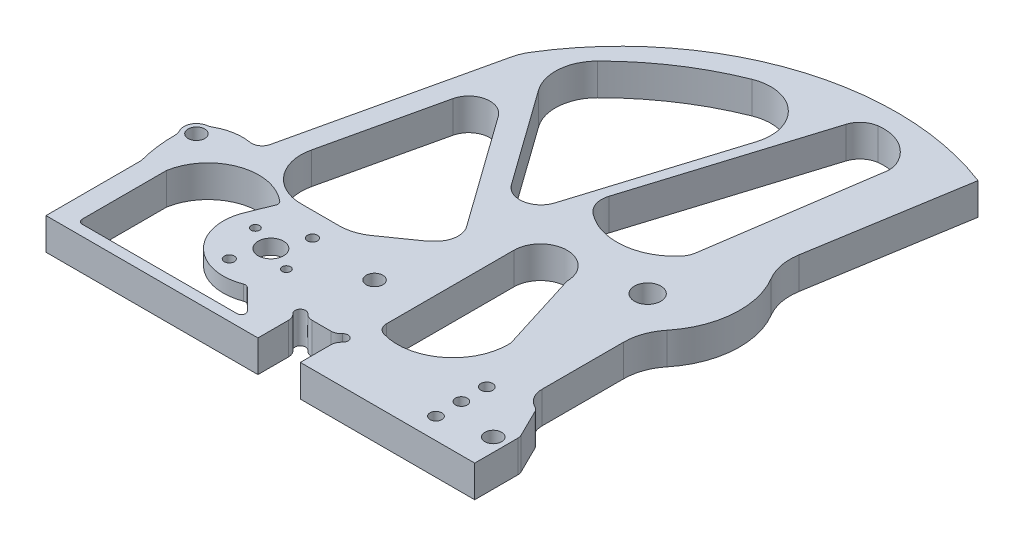
from build123d import *

# Parameters (mm, degrees)
SKETCH1_R                = 4.7625
SKETCH1_W                = 139.7
SKETCH1_H                = 38.1
BOSS_EXTRUDE1_DEPTH      = 9.525
CUT_EXTRUDE4_DEPTH       = 106.62050594
CUT_EXTRUDE4_DEPTH_BACK  = 106.62050594
SKETCH5_W                = 20.32
SKETCH5_H                = 77.381530754
FILLET9_R                = 12.7
BOSS_EXTRUDE4_DEPTH      = 9.525
FILLET13_R               = 12.7
FILLET14_R               = 6.35
CUT_EXTRUDE5_DEPTH       = 150.690104128
CUT_EXTRUDE5_DEPTH_BACK  = 150.690104128
SKETCH7_W                = 12.7
SKETCH7_H                = 6.35
FILLET15_R               = 1.27
SKETCH8_W                = 59.69
SKETCH8_H                = 3.175
SKETCH8_W_2              = 12.7
BOSS_EXTRUDE5_DEPTH      = 9.525
SKETCH9_R                = 14.2875
CUT_EXTRUDE6_DEPTH       = 5.08
CUT_EXTRUDE7_DEPTH       = 150.473101419
CUT_EXTRUDE7_DEPTH_BACK  = 150.473101419
SKETCH10_R               = 1.651
BOSS_EXTRUDE6_START      = -9.525
BOSS_EXTRUDE6_DEPTH      = 9.525
FILLET16_R               = 15.24
SKETCH12_R               = 1.25
SKETCH12_R_2             = 1.5
CUT_EXTRUDE8_DEPTH       = 4.445
CUT_EXTRUDE10_DEPTH      = 150.690104128
CUT_EXTRUDE10_DEPTH_BACK = 150.690104128
SKETCH13_R               = 2.4892
CUT_EXTRUDE11_DEPTH      = 150.690104128
CUT_EXTRUDE11_DEPTH_BACK = 150.690104128
SKETCH15_R               = 2.5
BOSS_EXTRUDE7_DEPTH      = 9.525
CUT_EXTRUDE12_DEPTH      = 150.690104128
CUT_EXTRUDE12_DEPTH_BACK = 150.690104128
SKETCH19_R               = 2.4892
BOSS_EXTRUDE8_DEPTH      = 9.525
SKETCH22_R               = 2.4892
BOSS_EXTRUDE9_DEPTH      = 9.525
CUT_EXTRUDE13_DEPTH      = 150.690104128
CUT_EXTRUDE13_DEPTH_BACK = 150.690104128
SKETCH23_R               = 2.4892
BOSS_EXTRUDE10_DEPTH     = 9.525
BOSS_EXTRUDE11_START     = -9.525
SKETCH26_R               = 2.4892
BOSS_EXTRUDE11_DEPTH     = 9.525
CUT_EXTRUDE14_DEPTH      = 150.690104128
CUT_EXTRUDE14_DEPTH_BACK = 150.690104128
SKETCH25_R               = 2.4892
SKETCH27_W               = 46.99
SKETCH27_H               = 3.175
BOSS_EXTRUDE12_DEPTH     = 9.525
CUT_EXTRUDE15_DEPTH      = 150.690104128
CUT_EXTRUDE15_DEPTH_BACK = 150.690104128
SKETCH28_R               = 1.778
CUT_EXTRUDE16_DEPTH      = 150.690104128
CUT_EXTRUDE16_DEPTH_BACK = 150.690104128
SKETCH29_W               = 12.7
SKETCH29_H               = 12.7
SKETCH31_R               = 2.4892
BOSS_EXTRUDE13_DEPTH     = 9.525
CUT_EXTRUDE18_DEPTH      = 150.690104128
CUT_EXTRUDE18_DEPTH_BACK = 150.690104128
FILLET17_R               = 0.127
FILLET18_R               = 1.27
FILLET19_R               = 1.27
CUT_EXTRUDE19_DEPTH      = 150.473101419
CUT_EXTRUDE19_DEPTH_BACK = 150.473101419
SKETCH32_R               = 3.81
CUT_EXTRUDE20_DEPTH      = 150.690104128
CUT_EXTRUDE20_DEPTH_BACK = 150.690104128
FILLET20_R               = 3.175
SKETCH34_R               = 2.4892
BOSS_EXTRUDE18_DEPTH     = 9.525
FILLET21_R               = 3.175
BOSS_EXTRUDE19_START     = -9.525
SKETCH35_R               = 4.7625
BOSS_EXTRUDE19_DEPTH     = 9.525
CUT_EXTRUDE21_DEPTH      = 151.848973616
CUT_EXTRUDE21_DEPTH_BACK = 151.848973616
SKETCH36_R               = 3.954177863
SKETCH37_R               = 2.5
BOSS_EXTRUDE20_DEPTH     = 9.525
CUT_EXTRUDE22_DEPTH      = 151.848973616
CUT_EXTRUDE22_DEPTH_BACK = 151.848973616
FILLET22_R               = 6.35
FILLET23_R               = 6.35
CUT_EXTRUDE23_DEPTH      = 151.848973616
CUT_EXTRUDE23_DEPTH_BACK = 151.848973616
SKETCH39_R               = 1.5875
FILLET24_R               = 3.175
CUT_EXTRUDE24_DEPTH      = 151.848973616
CUT_EXTRUDE24_DEPTH_BACK = 151.848973616
FILLET25_R               = 2.54


with BuildPart() as part:
    # Sketch1 → Boss-Extrude1 (new body)
    # profile 1 of 2: a face of its own
    with BuildSketch(Plane(origin=(0, 0, 0), x_dir=(1, 0, 0), z_dir=(0, 1, 0))):
        with BuildLine():
            Line((-2.585114067, 30.705073187), (-19.230283607, 19.05))
            Line((-19.230283607, 19.05), (65.876676898, 19.05))
            Line((65.876676898, 19.05), (45.762611627, 67.384672451))
            Line((45.762611627, 67.384672451), (47.126806193, 73.586403918))
            ThreePointArc((47.126806193, 73.586403918), (27.684344017, 77.91367928), (13.031924758, 64.421412702))
            Line((13.031924758, 64.421412702), (0.786820794, 49.82826606))
            Line((0.786820794, 49.82826606), (-2.585114067, 30.705073187))
        make_face()
        with Locations(Location((33.265795842, 57.15, 0), (0, 0, 90))):
            Circle(SKETCH1_R, mode=Mode.SUBTRACT)
    # profile 2 of 2: a face of its own
    with BuildSketch(Plane(origin=(0, 0, 0), x_dir=(1, 0, 0), z_dir=(0, 1, 0))):
        Rectangle(SKETCH1_W, SKETCH1_H)
    extrude(amount=BOSS_EXTRUDE1_DEPTH)

    # Sketch5 → Cut-Extrude4 (cut, two sides: drawn at the far end of the back side and taken through both)
    with BuildSketch(Plane(origin=(0, 9.525, 0), x_dir=(1, 0, 0), z_dir=(0, 1, 0)).offset(-CUT_EXTRUDE4_DEPTH_BACK)):
        with Locations((59.69, 19.640765377)):
            Rectangle(SKETCH5_W, SKETCH5_H)
    extrude(amount=CUT_EXTRUDE4_DEPTH + CUT_EXTRUDE4_DEPTH_BACK, mode=Mode.SUBTRACT)

    # Fillet9
    fillet9_edges = [part.edges().sort_by_distance(p)[0] for p in [
        (-69.85, 4.7625, -19.05),
    ]]
    fillet(fillet9_edges, radius=FILLET9_R)

    # Sketch6 → Boss-Extrude4 (add)
    with BuildSketch(Plane(origin=(0, 9.525, 0), x_dir=(1, 0, 0), z_dir=(0, 1, 0))):
        with BuildLine():
            Line((-40.820324649, 90.757686087), (-57.15, 19.05))
            Line((-57.15, 19.05), (-50.637428899, 19.05))
            Line((-50.637428899, 19.05), (-36.112276852, 82.833573217))
            Line((-36.112276852, 82.833573217), (-1.836902529, 34.948391683))
            Line((-1.836902529, 34.948391683), (-0.1716456, 44.392533029))
            Line((-0.1716456, 44.392533029), (-34.470324649, 92.310272954))
            ThreePointArc((-34.470324649, 92.310272954), (-8.640935119, 114.565679533), (23.975733889, 124.496106932))
            Line((23.975733889, 124.496106932), (0.786820794, 49.82826606))
            Line((0.786820794, 49.82826606), (13.031924758, 64.421412702))
            Line((13.031924758, 64.421412702), (31.934398309, 125.287003139))
            ThreePointArc((31.934398309, 125.287003139), (44.385059516, 123.609616522), (54.410069273, 116.037841977))
            Line((54.410069273, 116.037841977), (46.378042741, 65.905773934))
            Line((46.378042741, 65.905773934), (49.53, 58.331530754))
            Line((49.53, 58.331530754), (60.705279449, 126.478959373))
            ThreePointArc((60.705279449, 126.478959373), (3.349865177, 127.355587027), (-40.820324649, 90.757686087))
        make_face()
    extrude(amount=-BOSS_EXTRUDE4_DEPTH)

    # Fillet13
    # the kernel refuses this fillet: 12.7 mm, written as the material it adds along each edge
    with BuildSketch(Plane(origin=(-57.15, 0, -19.05), x_dir=(-0.976607789728772, 0, 0.2150284284486181), z_dir=(0, 1, 0))) as fillet13_piece_1:
        with BuildLine():
            CenterArc((8.192583124, -12.40291893), FILLET13_R, 102.417195144, 52.336673181)
            Line((-3.294362955, -6.986271462), (0, 0))
            ThreePointArc((0, 0), (2.730861041, -0.29708107), (5.461722083, 0))
        make_face()
    extrude(amount=9.525)
    with BuildSketch(Plane(origin=(-50.637428899, 9.525, -19.05), x_dir=(1, 0, 0), z_dir=(0, -1, 0))) as fillet13_piece_2:
        with BuildLine():
            CenterArc((FILLET13_R * 1.25332734135, -FILLET13_R), FILLET13_R, 90, 102.82893653)
            Line((FILLET13_R * 0.278290001752, -FILLET13_R * 1.22204095656), (0, 0))
            Line((0, 0), (FILLET13_R * 1.25332734135, 0))
        make_face()
    extrude(amount=9.525)
    with BuildSketch(Plane(origin=(-19.230283607, 0, -19.05), x_dir=(-1, 0, 0), z_dir=(0, 1, 0))) as fillet13_piece_3:
        with BuildLine():
            CenterArc((FILLET13_R * 0.315298788879, -FILLET13_R), FILLET13_R, 90, 35)
            Line((-FILLET13_R * 0.258277647472, -FILLET13_R * 0.180847955711), (0, 0))
            Line((0, 0), (FILLET13_R * 0.315298788879, 0))
        make_face()
    extrude(amount=9.525)
    with BuildSketch(Plane(origin=(-2.585114067, 0, -30.705073187), x_dir=(-0.8191520442889916, 0, 0.5735764363510465), z_dir=(0, 1, 0))) as fillet13_piece_4:
        with BuildLine():
            CenterArc((5.205813886, -12.7), FILLET13_R, 90, 40.527239041)
            Line((-3.046766513, -3.046766513), (0, 0))
            Line((0, 0), (5.205813886, 0))
        make_face()
    extrude(amount=9.525)
    with BuildSketch(Plane(origin=(-0.1716456, 9.525, -44.392533029), x_dir=(0.17364817766692364, 0, -0.9848077530122092), z_dir=(0, -1, 0))) as fillet13_piece_5:
        with BuildLine():
            CenterArc((18.211827751, -0.443902553), FILLET13_R, 177.996935086, 46.408641112)
            Line((9.138889548, -9.330510025), (0, 0))
            Line((0, 0), (5.519587975, 0))
        make_face()
    extrude(amount=9.525)
    with BuildSketch(Plane(origin=(-34.470324649, 9.525, -92.310272954), x_dir=(0.5820438339804168, 0, 0.8131574111605803), z_dir=(0, -1, 0))) as fillet13_piece_6:
        with BuildLine():
            CenterArc((10.022683965, -12.7), FILLET13_R, 90, 80.498431267)
            ThreePointArc((-2.503085779, -10.603552455), (-1.426521492, -5.260470594), (0, 0))
            Line((0, 0), (10.022683965, 0))
        make_face()
    extrude(amount=9.525)
    with BuildSketch(Plane(origin=(23.975733889, 9.525, -124.496106932), x_dir=(-0.9727888978014573, 0, 0.23169324615582948), z_dir=(0, -1, 0))) as fillet13_piece_7:
        with BuildLine():
            CenterArc((22.207665987, -12.564683169), FILLET13_R, 81.628600896, 129.02093184)
            Line((11.28183523, -19.03895705), (0, 0))
            ThreePointArc((0, 0), (12.028324322, 0.88028664), (24.056648644, 0))
        make_face()
    extrude(amount=9.525)
    with BuildSketch(Plane(origin=(31.934398309, 9.525, -125.287003139), x_dir=(-0.296587445495961, 0, 0.955005700074183), z_dir=(0, -1, 0))) as fillet13_piece_8:
        with BuildLine():
            CenterArc((10.776729045, -12.7), FILLET13_R, 90, 102.058397342)
            ThreePointArc((-1.643047789, -15.353138407), (-2.048828312, -7.545226689), (0, 0))
            Line((0, 0), (10.776729045, 0))
        make_face()
    extrude(amount=9.525)
    with BuildSketch(Plane(origin=(54.410069273, 9.525, -116.037841977), x_dir=(-0.7625288790738134, 0, -0.6469541781134376), z_dir=(0, -1, 0))) as fillet13_piece_9:
        with BuildLine():
            CenterArc((7.307662816, -12.447414705), FILLET13_R, 78.553776196, 70.236290439)
            Line((-3.554322534, -5.866588445), (0, 0))
            ThreePointArc((0, 0), (4.913976952, 0.492482128), (9.827953904, 0))
        make_face()
    extrude(amount=9.525)
    with BuildSketch(Plane(origin=(46.378042741, 9.525, -65.905773934), x_dir=(-0.38420224671210196, 0, -0.9232489553860178), z_dir=(0, -1, 0))) as fillet13_piece_10:
        with BuildLine():
            CenterArc((11.700711408, -7.700832885), FILLET13_R, 121.696641969, 20.976242523)
            Line((5.027854736, 3.104859311), (0, 0))
            Line((0, 0), (1.601841527, 0))
        make_face()
    extrude(amount=9.525)
    with BuildSketch(Plane(origin=(49.53, 9.525, -58.331530754), x_dir=(0, 0, 1), z_dir=(0, -1, 0))) as fillet13_piece_11:
        with BuildLine():
            CenterArc((FILLET13_R * 0.0814494597119, -FILLET13_R), FILLET13_R, 90, 9.312862987)
            Line((-FILLET13_R * 0.0803759078788, -FILLET13_R * 0.0131805887579), (0, 0))
            Line((0, 0), (FILLET13_R * 0.0814494597119, 0))
        make_face()
    extrude(amount=9.525)
    # the kernel refuses this fillet: 12.7 mm, written as the material it takes off along each edge
    with BuildSketch(Plane(origin=(47.126806193, -37.591362954, -73.586403918), x_dir=(-0.9416239493908574, 0, -0.33666650848215335), z_dir=(0, 1, 0))) as fillet13_2_piece_1:
        with BuildLine():
            CenterArc((10.595677472, 11.898264327), FILLET13_R, 206.160599148, 84.306815738)
            Line((-0.803357005, 6.298977498), (0, 0))
            ThreePointArc((0, 0), (7.518272591, -1.357317473), (15.036545181, 0))
        make_face()
    extrude(amount=84.707725907, mode=Mode.SUBTRACT)
    with BuildSketch(Plane(origin=(-40.820324649, 14.987530175, -90.757686087), x_dir=(-0.22204095655633596, 0, 0.9750373395986162), z_dir=(0, -1, 0))) as fillet13_2_piece_2:
        with BuildLine():
            CenterArc((2.010529188, -12.7), FILLET13_R, 90, 18.778808746)
            ThreePointArc((-2.077798274, -0.676041477), (-1.041128524, -0.331168767), (0, 0))
            Line((0, 0), (2.010529188, 0))
        make_face()
    extrude(amount=20.45006035, mode=Mode.SUBTRACT)

    # Fillet14
    fillet14_edges = [part.edges().sort_by_distance(p)[0] for p in [
        (0.786820794, 4.7625, -49.82826606),
        (-1.836902529, 4.7625, -34.948391683),
        (-36.112276852, 4.7625, -82.833573217),
        (13.031924758, 4.7625, -64.421412702),
        (45.762611627, 4.7625, -67.384672451),
    ]]
    fillet(fillet14_edges, radius=FILLET14_R)

    # Sketch7 → Cut-Extrude5 (cut, two sides: drawn at the far end of the back side and taken through both)
    with BuildSketch(Plane(origin=(0, 0, 0), x_dir=(-1, 0, 0), z_dir=(0, -1, 0)).offset(-CUT_EXTRUDE5_DEPTH_BACK)):
        with Locations((10.16, -15.875)):
            Rectangle(SKETCH7_W, SKETCH7_H)
    extrude(amount=CUT_EXTRUDE5_DEPTH + CUT_EXTRUDE5_DEPTH_BACK, mode=Mode.SUBTRACT)

    # Fillet15
    fillet15_edges = [part.edges().sort_by_distance(p)[0] for p in [
        (-3.81, 4.7625, 19.05),
    ]]
    fillet(fillet15_edges, radius=FILLET15_R)

    # Sketch8 → Boss-Extrude5 (add)
    with BuildSketch(Plane(origin=(0, 9.525, 0), x_dir=(1, 0, 0), z_dir=(0, 1, 0))):
        with Locations((-40.005, -20.6375)):
            Rectangle(SKETCH8_W, SKETCH8_H)
        with Locations((8.89, -20.6375)):
            Rectangle(SKETCH8_W_2, SKETCH8_H)
    extrude(amount=-BOSS_EXTRUDE5_DEPTH)

    # Sketch9 → Cut-Extrude6 (cut)
    with BuildSketch(Plane.XZ):
        with Locations(Location((-27.615671871, -2.921, 0), (0, 0, 270))):
            Circle(SKETCH9_R)
    extrude(amount=-CUT_EXTRUDE6_DEPTH, mode=Mode.SUBTRACT)

    # Sketch10 → Cut-Extrude7 (cut, two sides: drawn at the far end of the back side and taken through both)
    with BuildSketch(Plane(origin=(0, 5.08, 0), x_dir=(-1, 0, 0), z_dir=(0, -1, 0)).offset(-CUT_EXTRUDE7_DEPTH_BACK)):
        with Locations(Location((27.615671871, 2.921, 0), (0, 0, 90))):
            Circle(SKETCH10_R)
    extrude(amount=CUT_EXTRUDE7_DEPTH + CUT_EXTRUDE7_DEPTH_BACK, mode=Mode.SUBTRACT)

    # Sketch11 → Boss-Extrude6 (add)
    with BuildSketch(Plane(origin=(0, 9.525, 0), x_dir=(1, 0, 0), z_dir=(0, 1, 0)).offset(BOSS_EXTRUDE6_START)):
        with BuildLine():
            ThreePointArc((58.665795842, 57.15), (56.974586894, 66.263354312), (52.126171683, 74.163119148))
            Line((52.126171683, 74.163119148), (49.697393477, 59.352304784))
            ThreePointArc((49.697393477, 59.352304784), (49.571917546, 58.328116593), (49.53, 57.297122616))
            Line((49.53, 57.297122616), (49.53, 37.640113709))
            ThreePointArc((49.53, 37.640113709), (56.268738975, 46.378528086), (58.665795842, 57.15))
        make_face()
    extrude(amount=BOSS_EXTRUDE6_DEPTH)

    # Fillet16
    fillet16_edges = [part.edges().sort_by_distance(p)[0] for p in [
        (49.53, 4.7625, -37.640113709),
        (52.126171683, 4.7625, -74.163119148),
    ]]
    fillet(fillet16_edges, radius=FILLET16_R)

    # Sketch12 → Cut-Extrude8 (cut)
    with BuildSketch(Plane.XZ.offset(-5.08)):
        with Locations(Location((-35.289297033, -5.950517598, 0), (0, 0, 270))):
            Circle(SKETCH12_R)
        with Locations(Location((-31.140928712, 6.008309279, 0), (0, 0, 270))):
            Circle(SKETCH12_R_2)
        with Locations(Location((-19.942046709, 0.108517598, 0), (0, 0, 270))):
            Circle(SKETCH12_R)
        with Locations(Location((-24.090415029, -11.850309279, 0), (0, 0, 270))):
            Circle(SKETCH12_R_2)
    extrude(amount=-CUT_EXTRUDE8_DEPTH, mode=Mode.SUBTRACT)

    # Sketch13 → Cut-Extrude10 (cut, two sides: drawn at the far end of the back side and taken through both)
    with BuildSketch(Plane(origin=(0, 0, 0), x_dir=(-1, 0, 0), z_dir=(0, -1, 0)).offset(-CUT_EXTRUDE10_DEPTH_BACK)):
        with Locations(Location((28.399421405, -16.1925, 0), (0, 0, 90))):
            Circle(SKETCH13_R)
    extrude(amount=CUT_EXTRUDE10_DEPTH + CUT_EXTRUDE10_DEPTH_BACK, mode=Mode.SUBTRACT)

    # Sketch15 → Cut-Extrude11 (cut, two sides: drawn at the far end of the back side and taken through both)
    with BuildSketch(Plane(origin=(0, 9.525, 0), x_dir=(1, 0, 0), z_dir=(0, 1, 0)).offset(-CUT_EXTRUDE11_DEPTH_BACK)):
        with Locations(Location((40.5384, 70.866, 0), (0, 0, 270))):
            Circle(SKETCH15_R)
        with Locations(Location((35.179, 40.386, 0), (0, 0, 270))):
            Circle(SKETCH15_R)
        with Locations(Location((39.9034, 29.3624, 0), (0, 0, 270))):
            Circle(SKETCH15_R)
    extrude(amount=CUT_EXTRUDE11_DEPTH + CUT_EXTRUDE11_DEPTH_BACK, mode=Mode.SUBTRACT)

    # Sketch16 → Boss-Extrude7 (add)
    with BuildSketch(Plane(origin=(0, 9.525, 0), x_dir=(1, 0, 0), z_dir=(0, 1, 0))):
        Polygon((55.88, -6.35), (49.53, -12.7), (49.53, -19.05), (55.88, -19.05), (55.88, -15.875), (53.680295474, -17.145), (53.680295474, -10.795), (55.88, -12.065), align=None)
    extrude(amount=-BOSS_EXTRUDE7_DEPTH)

    # Sketch19 → Cut-Extrude12 (cut, two sides: drawn at the far end of the back side and taken through both)
    with BuildSketch(Plane(origin=(0, 9.525, 0), x_dir=(-1, 0, 0), z_dir=(0, 1, 0)).offset(-CUT_EXTRUDE12_DEPTH_BACK)):
        with Locations(Location((48.4632, -14.351, 0), (0, 0, 90))):
            Circle(SKETCH19_R)
        with Locations(Location((3.9116, -10.287, 0), (0, 0, 90))):
            Circle(SKETCH19_R)
    extrude(amount=CUT_EXTRUDE12_DEPTH + CUT_EXTRUDE12_DEPTH_BACK, mode=Mode.SUBTRACT)

    # Sketch20 → Boss-Extrude8 (add)
    with BuildSketch(Plane(origin=(0, 9.525, 0), x_dir=(1, 0, 0), z_dir=(0, 1, 0))):
        with BuildLine():
            Line((53.324928945, 109.264915052), (48.873430908, 81.480793378))
            ThreePointArc((48.873430908, 81.480793378), (45.343384883, 76.7569275), (39.450235559, 76.973548833))
            ThreePointArc((39.450235559, 76.973548833), (36.321510472, 78.245974803), (32.968035134, 78.648705083))
            Line((32.968035134, 78.648705083), (27.464748888, 77.853401555))
            ThreePointArc((27.464748888, 77.853401555), (21.199095236, 79.540910534), (19.68719134, 85.851239277))
            Line((19.68719134, 85.851239277), (28.738155771, 114.995165473))
            ThreePointArc((28.738155771, 114.995165473), (36.122591982, 123.00913189), (47.000010034, 122.349334627))
            ThreePointArc((47.000010034, 122.349334627), (52.21902206, 116.801248283), (53.324928945, 109.264915052))
        make_face()
    extrude(amount=-BOSS_EXTRUDE8_DEPTH)

    # Sketch22 → Boss-Extrude9 (add)
    with BuildSketch(Plane(origin=(0, 9.525, 0), x_dir=(1, 0, 0), z_dir=(0, 1, 0))):
        Polygon((62.23, 2.521193519), (49.53, -1.837516354), (49.53, -19.05), (62.23, -19.05), align=None)
        with Locations((54.129270233, -12.673767621)):
            Circle(SKETCH22_R, mode=Mode.SUBTRACT)
    extrude(amount=-BOSS_EXTRUDE9_DEPTH)

    # Sketch23 → Cut-Extrude13 (cut, two sides: drawn at the far end of the back side and taken through both)
    with BuildSketch(Plane(origin=(0, 9.525, 0), x_dir=(1, 0, 0), z_dir=(0, 1, 0)).offset(-CUT_EXTRUDE13_DEPTH_BACK)):
        with Locations(Location((54.129270233, -12.673767621, 0), (0, 0, 270))):
            Circle(SKETCH23_R)
    extrude(amount=CUT_EXTRUDE13_DEPTH + CUT_EXTRUDE13_DEPTH_BACK, mode=Mode.SUBTRACT)

    # Sketch24 → Boss-Extrude10 (add)
    with BuildSketch(Plane(origin=(0, 0, 0), x_dir=(-1, 0, 0), z_dir=(0, -1, 0))):
        Polygon((-62.23, -1.837516354), (-49.53, -1.837516354), (-49.53, 2.521193519), align=None)
    extrude(amount=-BOSS_EXTRUDE10_DEPTH)

    # Sketch26 → Boss-Extrude11 (add)
    with BuildSketch(Plane(origin=(0, 0, 0), x_dir=(-1, 0, 0), z_dir=(0, -1, 0)).offset(BOSS_EXTRUDE11_START)):
        with Locations((-54.129270233, -12.673767621)):
            Circle(SKETCH26_R)
    extrude(amount=BOSS_EXTRUDE11_DEPTH)

    # Sketch25 → Cut-Extrude14 (cut, two sides: drawn at the far end of the back side and taken through both)
    with BuildSketch(Plane(origin=(0, 0, 0), x_dir=(-1, 0, 0), z_dir=(0, -1, 0)).offset(-CUT_EXTRUDE14_DEPTH_BACK)):
        with Locations(Location((-54.61, -12.673767621, 0), (0, 0, 90))):
            Circle(SKETCH25_R)
        Polygon((-62.23, -1.837516354), (-55.88, 0.341838583), (-62.23, 2.521193519), align=None)
    extrude(amount=CUT_EXTRUDE14_DEPTH + CUT_EXTRUDE14_DEPTH_BACK, mode=Mode.SUBTRACT)

    # Sketch27 → Boss-Extrude12 (add)
    with BuildSketch(Plane(origin=(0, 9.525, 0), x_dir=(1, 0, 0), z_dir=(0, 1, 0))):
        with BuildLine():
            Line((-16.51, -12.7), (-16.51, -19.05))
            Line((-16.51, -19.05), (-10.16, -19.05))
            Line((-10.16, -19.05), (-10.16, -22.225))
            Line((-10.16, -22.225), (2.54, -22.225))
            Line((2.54, -22.225), (2.54, -19.05))
            Line((2.54, -19.05), (-2.54, -19.05))
            ThreePointArc((-2.54, -19.05), (-3.438025612, -18.678025612), (-3.81, -17.78))
            Line((-3.81, -17.78), (-3.81, -12.7))
            Line((-3.81, -12.7), (-16.51, -12.7))
        make_face()
        with Locations((38.735, -20.6375)):
            Rectangle(SKETCH27_W, SKETCH27_H)
    extrude(amount=-BOSS_EXTRUDE12_DEPTH)

    # Sketch28 → Cut-Extrude15 (cut, two sides: drawn at the far end of the back side and taken through both)
    with BuildSketch(Plane(origin=(0, 9.525, 0), x_dir=(1, 0, 0), z_dir=(0, 1, 0)).offset(-CUT_EXTRUDE15_DEPTH_BACK)):
        with Locations(Location((40.64, -8.255, 0), (0, 0, 270))):
            Circle(SKETCH28_R)
        with Locations(Location((40.64, -15.875, 0), (0, 0, 270))):
            Circle(SKETCH28_R)
        with Locations(Location((40.64, -0.635, 0), (0, 0, 270))):
            Circle(SKETCH28_R)
    extrude(amount=CUT_EXTRUDE15_DEPTH + CUT_EXTRUDE15_DEPTH_BACK, mode=Mode.SUBTRACT)

    # Sketch29 → Cut-Extrude16 (cut, two sides: drawn at the far end of the back side and taken through both)
    with BuildSketch(Plane(origin=(0, 9.525, 0), x_dir=(1, 0, 0), z_dir=(0, 1, 0)).offset(-CUT_EXTRUDE16_DEPTH_BACK)):
        with Locations((0, -15.875)):
            Rectangle(SKETCH29_W, SKETCH29_H)
    extrude(amount=CUT_EXTRUDE16_DEPTH + CUT_EXTRUDE16_DEPTH_BACK, mode=Mode.SUBTRACT)

    # Sketch31 → Boss-Extrude13 (add)
    with BuildSketch(Plane(origin=(0, 0, 0), x_dir=(-1, 0, 0), z_dir=(0, -1, 0))):
        with Locations((28.399421405, -16.1925)):
            Circle(SKETCH31_R)
        with Locations((48.4632, 14.351)):
            Circle(SKETCH31_R)
    extrude(amount=-BOSS_EXTRUDE13_DEPTH)

    # Sketch30 → Cut-Extrude18 (cut, two sides: drawn at the far end of the back side and taken through both)
    with BuildSketch(Plane(origin=(0, 0, 0), x_dir=(-1, 0, 0), z_dir=(0, -1, 0)).offset(-CUT_EXTRUDE18_DEPTH_BACK)):
        with BuildLine():
            Line((37.785022503, 15.808446025), (40.659420262, 8.751375987))
            ThreePointArc((40.659420262, 8.751375987), (37.681594614, -7.218519494), (21.690430171, -10.079929469))
            Line((21.690430171, -10.079929469), (12.7, -19.05))
            Line((12.7, -19.05), (63.5, -19.05))
            Line((63.5, -19.05), (63.5, 7.557611872))
            ThreePointArc((63.5, 7.557611872), (53.139903501, 19.466531114), (37.785022503, 15.808446025))
        make_face()
    extrude(amount=CUT_EXTRUDE18_DEPTH + CUT_EXTRUDE18_DEPTH_BACK, mode=Mode.SUBTRACT)

    # Fillet17
    fillet17_edges = [part.edges().sort_by_distance(p)[0] for p in [
        (-40.659420262, 2.54, -8.751375987),
    ]]
    fillet(fillet17_edges, radius=FILLET17_R)

    # Fillet18
    fillet18_edges = [part.edges().sort_by_distance(p)[0] for p in [
        (-21.690430171, 2.54, 10.079929469),
        (-63.5, 4.7625, 19.05),
        (-12.7, 4.7625, 19.05),
        (-37.785022503, 4.7625, -15.808446025),
    ]]
    fillet(fillet18_edges, radius=FILLET18_R)

    # Fillet19
    fillet19_edges = [part.edges().sort_by_distance(p)[0] for p in [
        (-21.690430171, 7.3025, 10.079929469),
    ]]
    fillet(fillet19_edges, radius=FILLET19_R)

    # Sketch32 → Cut-Extrude19 (cut, two sides: drawn at the far end of the back side and taken through both)
    with BuildSketch(Plane(origin=(0, 5.08, 0), x_dir=(-1, 0, 0), z_dir=(0, -1, 0)).offset(-CUT_EXTRUDE19_DEPTH_BACK)):
        with Locations(Location((27.615671871, 2.921, 0), (0, 0, 90))):
            Circle(SKETCH32_R)
    extrude(amount=CUT_EXTRUDE19_DEPTH + CUT_EXTRUDE19_DEPTH_BACK, mode=Mode.SUBTRACT)

    # Sketch33 → Cut-Extrude20 (cut, two sides: drawn at the far end of the back side and taken through both)
    with BuildSketch(Plane(origin=(0, 0, 0), x_dir=(-1, 0, 0), z_dir=(0, -1, 0)).offset(-CUT_EXTRUDE20_DEPTH_BACK)):
        with BuildLine():
            Line((-9.236629618, -1.482455529), (-9.236629618, 38.872796388))
            ThreePointArc((-9.236629618, 38.872796388), (-17.220769776, 46.856936546), (-25.204909934, 38.872796388))
            Line((-25.204909934, 38.872796388), (-32.863160036, 14.345276684))
            ThreePointArc((-32.863160036, 14.345276684), (-25.499799964, -0.211096236), (-9.236629618, -1.482455529))
        make_face()
    extrude(amount=CUT_EXTRUDE20_DEPTH + CUT_EXTRUDE20_DEPTH_BACK, mode=Mode.SUBTRACT)

    # Fillet20
    fillet20_edges = [part.edges().sort_by_distance(p)[0] for p in [
        (9.236629618, 4.7625, 1.482455529),
        (32.863160036, 4.7625, -14.345276684),
        (25.204909934, 4.7625, -38.872796388),
    ]]
    fillet(fillet20_edges, radius=FILLET20_R)

    # Sketch34 → Boss-Extrude18 (add)
    with BuildSketch(Plane(origin=(0, 0, 0), x_dir=(-1, 0, 0), z_dir=(0, -1, 0))):
        with BuildLine():
            ThreePointArc((55.434946449, 26.58122882), (57.947786582, 21.409249742), (62.483960331, 17.875574484))
            ThreePointArc((62.483960331, 17.875574484), (67.851198442, 13.189177721), (69.85, 6.35))
            ThreePointArc((69.85, 6.35), (71.069121044, 12.654062355), (71.365774043, 19.068066976))
            ThreePointArc((71.365774043, 19.068066976), (71.965503083, 23.098786841), (68.540924942, 25.307551677))
            ThreePointArc((68.540924942, 25.307551677), (62.138490057, 27.493575796), (55.434946449, 26.58122882))
        make_face()
        with Locations(Location((68.540924942, 21.548351677, 0), (0, 0, 90))):
            Circle(SKETCH34_R, mode=Mode.SUBTRACT)
    extrude(amount=-BOSS_EXTRUDE18_DEPTH)

    # Fillet21
    fillet21_edges = [part.edges().sort_by_distance(p)[0] for p in [
        (-55.434946449, 4.7625, -26.58122882),
        (-69.85, 4.7625, -6.35),
        (-71.365774043, 4.7625, -19.068066976),
        (-68.540924942, 4.7625, -25.307551677),
    ]]
    fillet(fillet21_edges, radius=FILLET21_R)

    # Sketch35 → Boss-Extrude19 (add)
    with BuildSketch(Plane(origin=(0, 9.525, 0), x_dir=(1, 0, 0), z_dir=(0, 1, 0)).offset(BOSS_EXTRUDE19_START)):
        with Locations((33.265795842, 57.15)):
            Circle(SKETCH35_R)
    extrude(amount=BOSS_EXTRUDE19_DEPTH)

    # Sketch36 → Cut-Extrude21 (cut, two sides: drawn at the far end of the back side and taken through both)
    with BuildSketch(Plane(origin=(0, 9.525, 0), x_dir=(1, 0, 0), z_dir=(0, 1, 0)).offset(-CUT_EXTRUDE21_DEPTH_BACK)):
        with Locations(Location((40.553778264, 47.6504, 0), (0, 0, 270))):
            Circle(SKETCH36_R)
    extrude(amount=CUT_EXTRUDE21_DEPTH + CUT_EXTRUDE21_DEPTH_BACK, mode=Mode.SUBTRACT)

    # Sketch37 → Boss-Extrude20 (add)
    with BuildSketch(Plane(origin=(0, 9.525, 0), x_dir=(1, 0, 0), z_dir=(0, 1, 0))):
        with Locations((39.9034, 29.3624)):
            Circle(SKETCH37_R)
        with Locations((35.179, 40.386)):
            Circle(SKETCH37_R)
        with Locations((40.5384, 70.866)):
            Circle(SKETCH37_R)
    extrude(amount=-BOSS_EXTRUDE20_DEPTH)

    # Sketch38 → Cut-Extrude22 (cut, two sides: drawn at the far end of the back side and taken through both)
    with BuildSketch(Plane(origin=(0, 9.525, 0), x_dir=(1, 0, 0), z_dir=(0, 1, 0)).offset(-CUT_EXTRUDE22_DEPTH_BACK)):
        with BuildLine():
            Line((27.215373287, 124.222575769), (8.382070498, 63.579713814))
            ThreePointArc((8.382070498, 63.579713814), (22.718414135, 56.392162992), (36.951474513, 63.782131055))
            Line((36.951474513, 63.782131055), (44.761350048, 116.547284747))
            ThreePointArc((44.761350048, 116.547284747), (37.933198667, 124.830893897), (27.215373287, 124.222575769))
        make_face()
    extrude(amount=CUT_EXTRUDE22_DEPTH + CUT_EXTRUDE22_DEPTH_BACK, mode=Mode.SUBTRACT)

    # Fillet22
    fillet22_edges = [part.edges().sort_by_distance(p)[0] for p in [
        (27.215373287, 4.7625, -124.222575769),
        (44.761350048, 4.7625, -116.547284747),
        (36.951474513, 4.7625, -63.782131055),
        (8.382070498, 4.7625, -63.579713814),
    ]]
    fillet(fillet22_edges, radius=FILLET22_R)

    # Fillet23
    fillet23_edges = [part.edges().sort_by_distance(p)[0] for p in [
        (49.53, 4.7625, -2.521193519),
    ]]
    fillet(fillet23_edges, radius=FILLET23_R)

    # Sketch39 → Cut-Extrude23 (cut, two sides: drawn at the far end of the back side and taken through both)
    with BuildSketch(Plane(origin=(0, 9.525, 0), x_dir=(1, 0, 0), z_dir=(0, 1, 0)).offset(-CUT_EXTRUDE23_DEPTH_BACK)):
        with Locations((6.35, -9.525)):
            Circle(SKETCH39_R)
        with Locations((-6.35, -9.525)):
            Circle(SKETCH39_R)
    extrude(amount=CUT_EXTRUDE23_DEPTH + CUT_EXTRUDE23_DEPTH_BACK, mode=Mode.SUBTRACT)

    # Fillet24
    fillet24_edges = [part.edges().sort_by_distance(p)[0] for p in [
        (6.35, 4.7625, 11.1125),
        (-4.7625, 4.7625, 9.525),
        (4.7625, 4.7625, 9.525),
        (-6.35, 4.7625, 11.1125),
    ]]
    fillet(fillet24_edges, radius=FILLET24_R)

    # Sketch41 → Cut-Extrude24 (cut, two sides: drawn at the far end of the back side and taken through both)
    with BuildSketch(Plane(origin=(0, 0, 0), x_dir=(-1, 0, 0), z_dir=(0, -1, 0)).offset(-CUT_EXTRUDE24_DEPTH_BACK)):
        Polygon((-53.818668436, 1.049298916), (-58.605135284, -8.618704349), (-58.605135284, -22.225), (-62.23, -22.225), (-62.23, -1.837516354), align=None)
    extrude(amount=CUT_EXTRUDE24_DEPTH + CUT_EXTRUDE24_DEPTH_BACK, mode=Mode.SUBTRACT)

    # Fillet25
    fillet25_edges = [part.edges().sort_by_distance(p)[0] for p in [
        (58.605135284, 4.7625, 8.618704349),
        (53.818668436, 4.7625, -1.049298916),
    ]]
    fillet(fillet25_edges, radius=FILLET25_R)


solid = part.part
